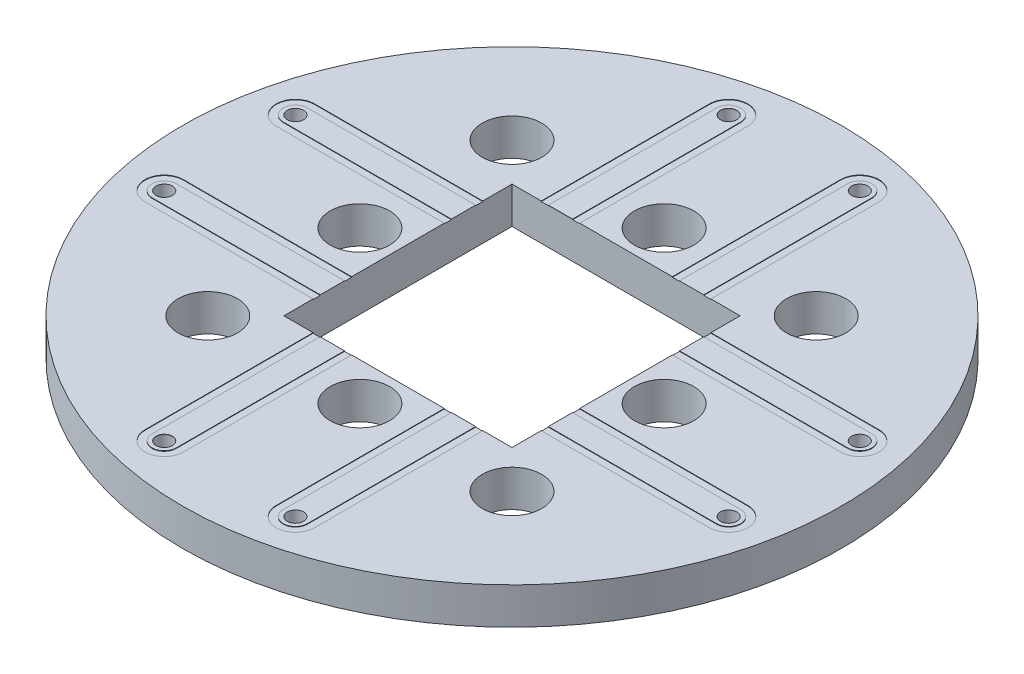
from build123d import *

# Parameters (mm, degrees)
BODAY_SKETCH_R    = 11.557
BODY_DEPTH        = 1.27
COPPER_START      = 0.017500092
COPPER_SKETCH_R   = 11.557
COPPER_DEPTH      = 0.017500092
GAP_CUT_DEPTH     = 17.39333395
CENTER_DEPTH      = 0.017500092
IO_HOLE_SKETCH_R  = 0.287000061
IO_HOLE_DEPTH     = 17.39333395
GAP_CUTS_COUNT    = 4
CENTERS_COUNT     = 4
IO_HOLES_COUNT    = 4
POCKET_DEPTH      = 17.39333395
POCKET_DEPTH_BACK = 17.39333395
POCKET_SKETCH_W   = 8.000000002
POCKET_SKETCH_H   = 8.000000002
POSTS_R           = 1.0414
POST_CUT_DEPTH    = 17.39333395
POST_CUTS_COUNT   = 4


with BuildPart() as part:
    # Boday Sketch → Body (new body)
    with BuildSketch(Plane(origin=(0, 0, 0), x_dir=(1, 0, 0), z_dir=(0, 1, 0))):
        Circle(BODAY_SKETCH_R)
    extrude(amount=-BODY_DEPTH)

    # Copper Sketch → Copper (add)
    with BuildSketch(Plane(origin=(0, 0, 0), x_dir=(1, 0, 0), z_dir=(0, 1, 0)).offset(COPPER_START)):
        Circle(COPPER_SKETCH_R)
    extrude(amount=-COPPER_DEPTH)

    # Gap → Gap Cut (cut, through all)
    with BuildSketch(Plane(origin=(0, 0, 0), x_dir=(1, 0, 0), z_dir=(0, 1, 0))):
        with BuildLine():
            Line((-2.975000019, 9.896241717), (-2.975000019, -9.896241717))
            ThreePointArc((-2.975000019, -9.896241717), (-2.299999972, -10.571241764), (-1.624999925, -9.896241717))
            Line((-1.624999925, -9.896241717), (-1.624999925, 9.896241717))
            ThreePointArc((-1.624999925, 9.896241717), (-2.299999972, 10.571241764), (-2.975000019, 9.896241717))
        make_face()
    gap_cut = extrude(amount=GAP_CUT_DEPTH, mode=Mode.SUBTRACT)


with BuildPart() as body_2:
    # Center Sketch → Center (new body)
    with BuildSketch(Plane(origin=(0, 0, 0), x_dir=(1, 0, 0), z_dir=(0, 1, 0))):
        with BuildLine():
            Line((-2.725000011, 9.896241717), (-2.725000011, -9.896241717))
            ThreePointArc((-2.725000011, -9.896241717), (-2.299999972, -10.321241756), (-1.874999933, -9.896241717))
            Line((-1.874999933, -9.896241717), (-1.874999933, 9.896241717))
            ThreePointArc((-1.874999933, 9.896241717), (-2.299999972, 10.321241756), (-2.725000011, 9.896241717))
        make_face()
    center = extrude(amount=CENTER_DEPTH)


with BuildPart() as io_hole_tool:
    # IO Hole Sketch → IO Hole (new, symmetric)
    with BuildSketch(Plane(origin=(0, 0, 0), x_dir=(1, 0, 0), z_dir=(0, 1, 0))):
        with Locations((-2.299999972, 9.896241717)):
            Circle(IO_HOLE_SKETCH_R)
        with Locations((-2.299999972, -9.896241717)):
            Circle(IO_HOLE_SKETCH_R)
    io_hole = extrude(amount=IO_HOLE_DEPTH, both=True)


with BuildPart() as part_1:
    add(part.part)

    # IO Hole: cut by io_hole_tool
    add(io_hole_tool.part, mode=Mode.SUBTRACT)

    # Gap Cuts: Gap Cut ×4 about axis
    gap_cuts_axis = Axis((0, 0.0762, 0), (0, -1, 0))
    for i in range(1, GAP_CUTS_COUNT):
        add(gap_cut.rotate(gap_cuts_axis, i * 360 / GAP_CUTS_COUNT), mode=Mode.SUBTRACT)

    # Centers: Center ×4 about axis
    centers_axis = Axis((0, 0.0762, 0), (0, -1, 0))
    for i in range(1, CENTERS_COUNT):
        add(center.rotate(centers_axis, i * 360 / CENTERS_COUNT))

    # IO Holes: IO Hole ×4 about axis
    io_holes_axis = Axis((0, 0.0762, 0), (0, -1, 0))
    for i in range(1, IO_HOLES_COUNT):
        add(io_hole.rotate(io_holes_axis, i * 360 / IO_HOLES_COUNT), mode=Mode.SUBTRACT)


with BuildPart() as body_2_1:
    add(body_2.part)

    # IO Hole: cut by io_hole_tool
    add(io_hole_tool.part, mode=Mode.SUBTRACT)


with BuildPart() as pocket_tool:
    # Pocket Sketch → Pocket (new, two sides: drawn at the far end of the back side and taken through both)
    with BuildSketch(Plane(origin=(0, 0, 0), x_dir=(1, 0, 0), z_dir=(0, 1, 0)).offset(-POCKET_DEPTH_BACK)):
        Rectangle(POCKET_SKETCH_W, POCKET_SKETCH_H)
    extrude(amount=POCKET_DEPTH + POCKET_DEPTH_BACK)


with BuildPart() as part_2:
    add(part_1.part)

    # Pocket: cut by pocket_tool
    add(pocket_tool.part, mode=Mode.SUBTRACT)

    # Posts → Post Cut (cut, symmetric)
    with BuildSketch(Plane(origin=(0, 0, 0), x_dir=(1, 0, 0), z_dir=(0, 1, 0))):
        with Locations((0, 5.334)):
            Circle(POSTS_R)
        with Locations((-5.334, 5.334)):
            Circle(POSTS_R)
    post_cut = extrude(amount=POST_CUT_DEPTH, both=True, mode=Mode.SUBTRACT)

    # Post Cuts: Post Cut ×4 about axis
    post_cuts_axis = Axis((0, 0.0762, 0), (0, -1, 0))
    for i in range(1, POST_CUTS_COUNT):
        add(post_cut.rotate(post_cuts_axis, i * 360 / POST_CUTS_COUNT), mode=Mode.SUBTRACT)


with BuildPart() as body_2_2:
    add(body_2_1.part)

    # Pocket: cut by pocket_tool
    add(pocket_tool.part, mode=Mode.SUBTRACT)


solid = Compound([part_2.part, body_2_2.part])
